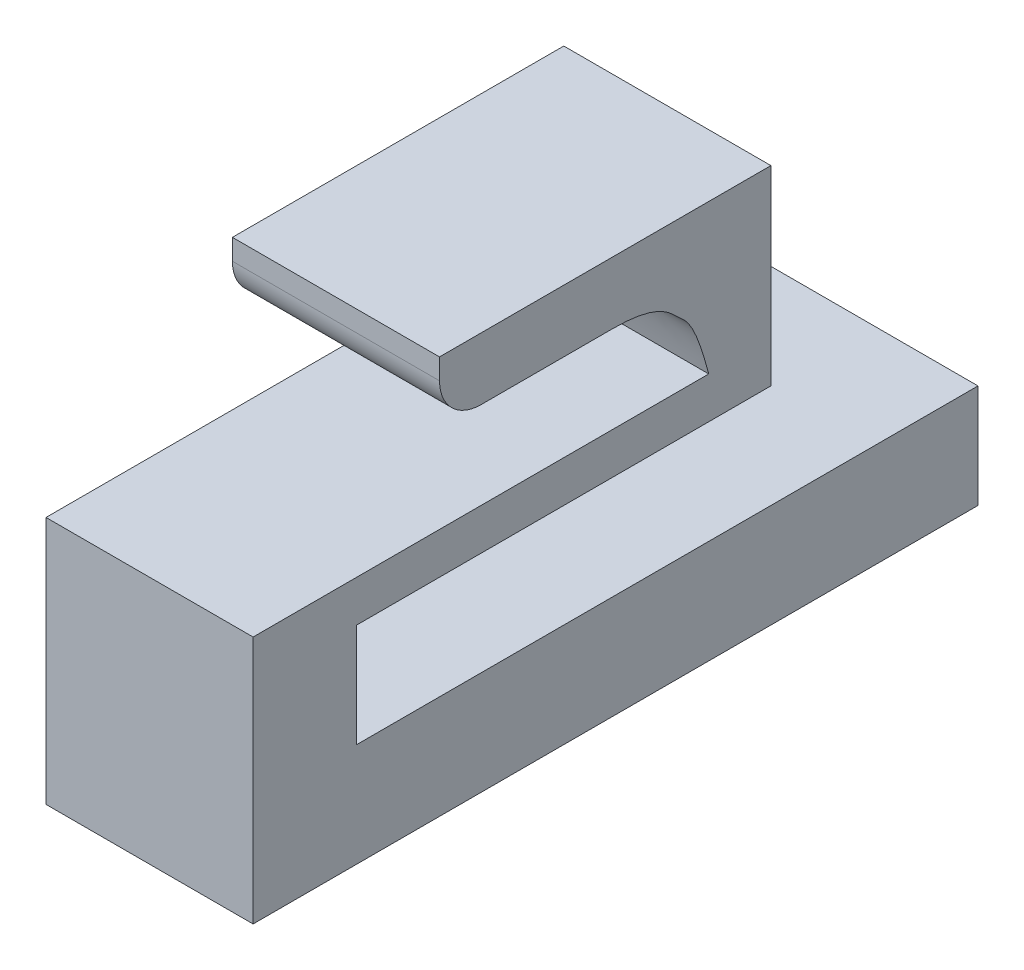
from build123d import *

# Parameters (mm, degrees)
BOSS_EXTRUDE1_DEPTH = 10


with BuildPart() as part:
    # Sketch2 → Boss-Extrude1 (new body)
    with BuildSketch(Plane(origin=(0, 0, 0), x_dir=(0, 0, -1), z_dir=(1, 0, 0))):
        with BuildLine():
            add(Edge.make_bspline(
                [(17.34537745, 16.212962963), (19.506174761, 16.212962963), (20.639551319, 14.872704948), (21.327327817, 14.502936293), (22, 12)],
                knots=[0, 0, 0, 0, 0.495488683, 1, 1, 1, 1], degree=3))
            Line((22, 12), (0, 12))
            Line((0, 12), (0, 0))
            Line((0, 0), (35, 0))
            Line((35, 0), (35, 5))
            Line((35, 5), (5, 5))
            Line((5, 5), (5, 10))
            Line((5, 10), (25, 10))
            Line((25, 10), (25, 19.212962963))
            Line((25, 19.212962963), (9, 19.212962963))
            Line((9, 19.212962963), (9, 18.212962963))
            ThreePointArc((9, 18.212962963), (9.585786438, 16.798749401), (11, 16.212962963))
            Line((11, 16.212962963), (17.34537745, 16.212962963))
        make_face()
    extrude(amount=BOSS_EXTRUDE1_DEPTH)


solid = part.part
